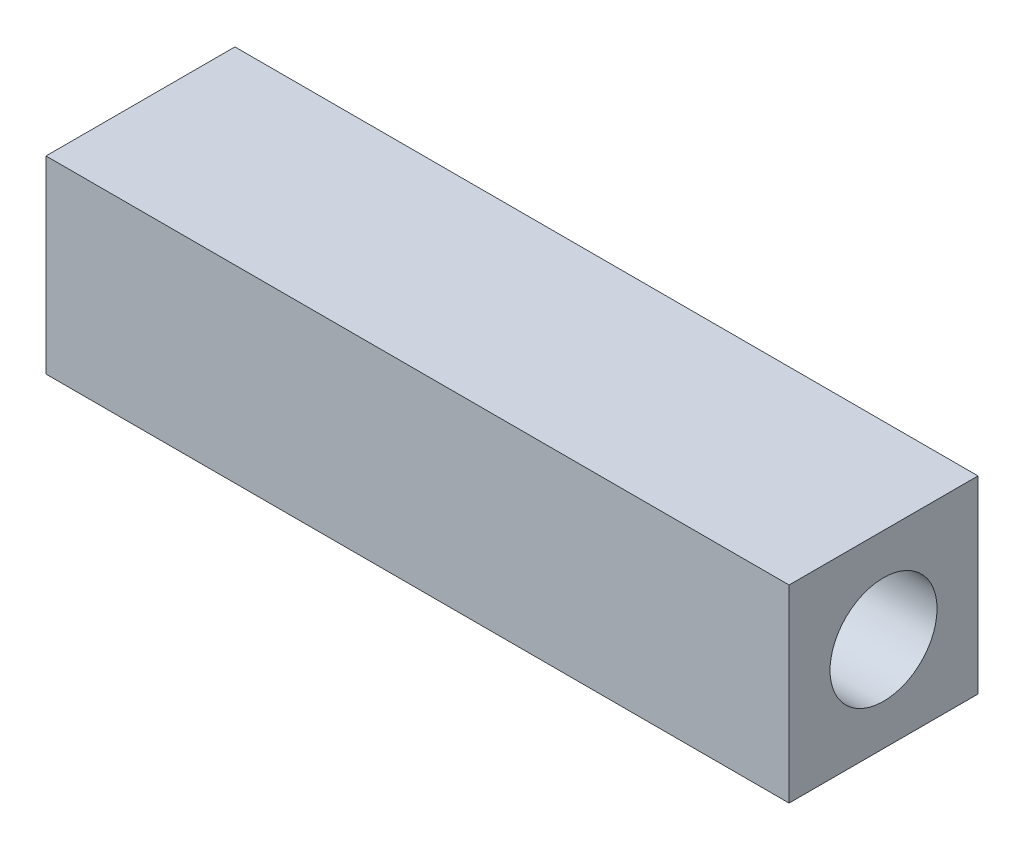
from build123d import *

# Parameters (mm, degrees)
SKETCH1_W           = 30
SKETCH1_H           = 30
BOSS_EXTRUDE1_DEPTH = 118
SKETCH2_R           = 8.5
CUT_EXTRUDE1_DEPTH  = 19
SKETCH3_R           = 9
CUT_EXTRUDE2_DEPTH  = 26
SKETCH4_R           = 10
CUT_EXTRUDE3_DEPTH  = 32
SKETCH5_R           = 8.5
CUT_EXTRUDE4_DEPTH  = 44
FILLET3_R           = 10
FILLET4_R           = 3
FILLET5_R           = 3
FILLET6_R           = 3
FILLET7_R           = 3
FILLET8_R           = 3


with BuildPart() as part:
    # Sketch1 → Boss-Extrude1 (new body)
    with BuildSketch(Plane(origin=(0, 0, 0), x_dir=(0, 0, -1), z_dir=(1, 0, 0))):
        Rectangle(SKETCH1_W, SKETCH1_H)
    extrude(amount=BOSS_EXTRUDE1_DEPTH)

    # Sketch2 → Cut-Extrude1 (cut)
    with BuildSketch(Plane(origin=(118, 0, 0), x_dir=(0, 0, -1), z_dir=(1, 0, 0))):
        Circle(SKETCH2_R)
    extrude(amount=-CUT_EXTRUDE1_DEPTH, mode=Mode.SUBTRACT)

    # Sketch3 → Cut-Extrude2 (cut)
    with BuildSketch(Plane(origin=(99, 0, 0), x_dir=(0, 0, -1), z_dir=(1, 0, 0))):
        Circle(SKETCH3_R)
    extrude(amount=-CUT_EXTRUDE2_DEPTH, mode=Mode.SUBTRACT)

    # Sketch4 → Cut-Extrude3 (cut)
    with BuildSketch(Plane(origin=(73, 0, 0), x_dir=(0, 0, -1), z_dir=(1, 0, 0))):
        Circle(SKETCH4_R)
    extrude(amount=-CUT_EXTRUDE3_DEPTH, mode=Mode.SUBTRACT)

    # Sketch5 → Cut-Extrude4 (cut)
    with BuildSketch(Plane(origin=(41, 0, 0), x_dir=(0, 0, -1), z_dir=(1, 0, 0))):
        Circle(SKETCH5_R)
    extrude(amount=-CUT_EXTRUDE4_DEPTH, mode=Mode.SUBTRACT)

    # Fillet3
    # the kernel refuses this fillet: 10 mm, written as the material it takes off along each edge
    with BuildSketch(Plane(origin=(41, 0, 0), x_dir=(0, 0, -1), z_dir=(0, -1, 0))) as fillet3_piece_1:
        with BuildLine():
            CenterArc((18.5, -5.267826876), FILLET3_R, 148.211669383, 31.788330617)
            Line((10, 0), (9.83, 0.105356538))
            ThreePointArc((9.83, 0.105356538), (9.25, 0.2), (8.5, 0.2))
            Line((8.5, 0.2), (8.3, 0))
            Line((8.3, 0), (8.3, -5.267826876))
            Line((8.3, -5.267826876), (8.5, -5.267826876))
        make_face()
    revolve(axis=Axis((41, 0, 0), (1, 0, 0)), mode=Mode.SUBTRACT)

    # Fillet4
    fillet4_edges = [part.edges().sort_by_distance(p)[0] for p in [
        (41, 0, 10),
    ]]
    fillet(fillet4_edges, radius=FILLET4_R)

    # Fillet5
    # the kernel refuses this fillet: 3 mm, written as the material it takes off along each edge
    with BuildSketch(Plane(origin=(73, 0, 0), x_dir=(0, 0, -1), z_dir=(0, -1, 0))) as fillet5_piece_1:
        with BuildLine():
            CenterArc((12, 2.236067977), FILLET5_R, 180, 48.189685104)
            Line((9, 2.236067977), (8.94, 2.236067977))
            Line((8.94, 2.236067977), (8.94, 0))
            Line((8.94, 0), (9, -0.06))
            ThreePointArc((9, -0.06), (9.5, -0.06), (9.96, -0.04472136))
            Line((9.96, -0.04472136), (10, 0))
        make_face()
    revolve(axis=Axis((73, 0, 0), (1, 0, 0)), mode=Mode.SUBTRACT)

    # Fillet6
    fillet6_edges = [part.edges().sort_by_distance(p)[0] for p in [
        (73, 0, 10),
    ]]
    fillet(fillet6_edges, radius=FILLET6_R)

    # Fillet7
    # the kernel refuses this fillet: 3 mm, written as the material it takes off along each edge
    with BuildSketch(Plane(origin=(99, 0, 0), x_dir=(0, 0, -1), z_dir=(0, -1, 0))) as fillet7_piece_1:
        with BuildLine():
            CenterArc((11.5, 1.658312395), FILLET7_R, 180, 33.557309762)
            Line((8.5, 1.658312395), (8.44, 1.658312395))
            Line((8.44, 1.658312395), (8.44, 0))
            Line((8.44, 0), (8.5, -0.06))
            ThreePointArc((8.5, -0.06), (8.75, -0.06), (8.95, -0.033166248))
            Line((8.95, -0.033166248), (9, 0))
        make_face()
    revolve(axis=Axis((99, 0, 0), (1, 0, 0)), mode=Mode.SUBTRACT)

    # Fillet8
    fillet8_edges = [part.edges().sort_by_distance(p)[0] for p in [
        (99, 0, 9),
    ]]
    fillet(fillet8_edges, radius=FILLET8_R)


solid = part.part
